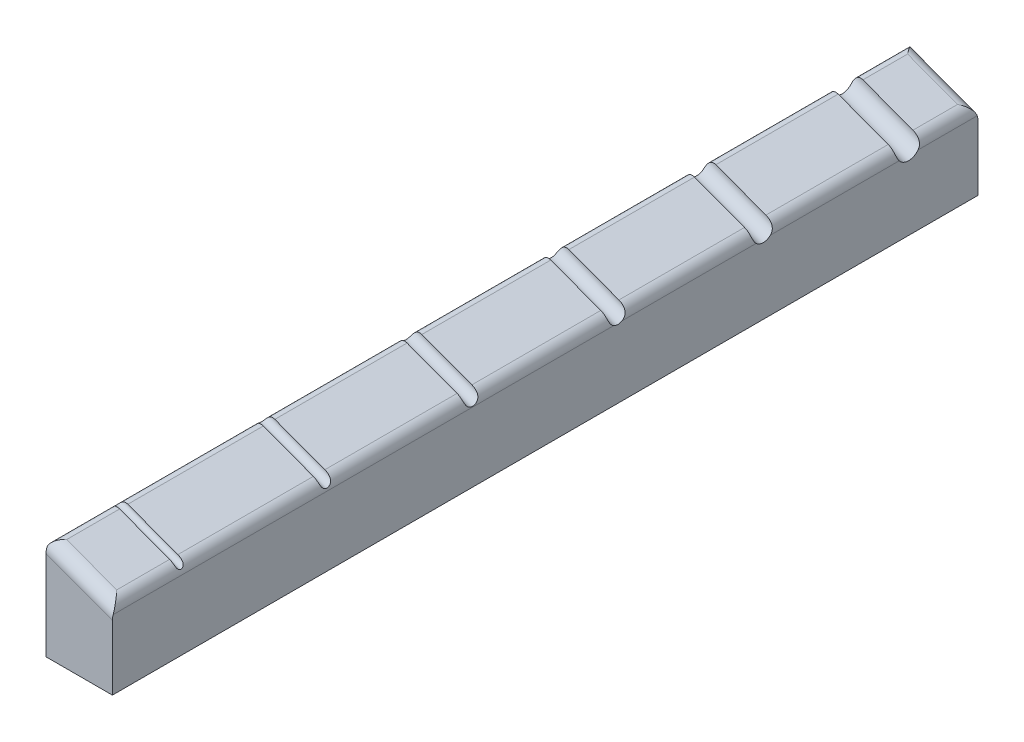
from build123d import *

# Parameters (mm, degrees)
SKETCH1_W           = 3.22
SKETCH1_H           = 41.98
BOSS_EXTRUDE1_DEPTH = 4.98
CUT_EXTRUDE1_DEPTH  = 41.98
FILLET1_R           = 0.6
FILLET2_R           = 0.3
SKETCH4_R           = 0.6
SKETCH4_R_2         = 0.2
SKETCH4_R_3         = 0.28
SKETCH4_R_4         = 0.36
SKETCH4_R_5         = 0.44
SKETCH4_R_6         = 0.52
CUT_EXTRUDE2_DEPTH  = 4.98


with BuildPart() as part:
    # Sketch1 → Boss-Extrude1 (new body)
    with BuildSketch(Plane(origin=(0, 0, 0), x_dir=(1, 0, 0), z_dir=(0, 1, 0))):
        with Locations((1.61, -20.99)):
            Rectangle(SKETCH1_W, SKETCH1_H)
    extrude(amount=BOSS_EXTRUDE1_DEPTH)

    # Sketch2 → Cut-Extrude1 (cut)
    with BuildSketch(Plane.XY.offset(41.98)):
        Polygon((0, 4.98), (3.22, 4.98), (3.22, 3.78), align=None)
    extrude(amount=-CUT_EXTRUDE1_DEPTH, mode=Mode.SUBTRACT)

    # Fillet1
    fillet1_edges = [part.edges().sort_by_distance(p)[0] for p in [
        (3.22, 3.78, 20.99),
        (1.61, 4.38, 41.98),
        (1.61, 4.38, 0),
    ]]
    fillet(fillet1_edges, radius=FILLET1_R)

    # Fillet2
    # the kernel refuses this fillet: 0.3 mm, written as the material it takes off along each edge
    with BuildSketch(Plane(origin=(0, 4.98, 42.459891752), x_dir=(0, -1, 0), z_dir=(0, 0, -1))) as fillet2_piece_1:
        with BuildLine():
            CenterArc((FILLET2_R * 1.43985566994, -FILLET2_R), FILLET2_R, 90, 110.438955915)
            Line((FILLET2_R * 0.50281089434, -FILLET2_R * 1.34920923314), (0, 0))
            Line((0, 0), (FILLET2_R * 1.43985566994, 0))
        make_face()
    extrude(amount=42.939783505, mode=Mode.SUBTRACT)

    # Sketch4 → Cut-Extrude2 (cut)
    with BuildSketch(Plane(origin=(-1.629578944, 0.607296501, 0), x_dir=(0, 0, 1), z_dir=(-0.9370447756039936, 0.3492092331443447, 0))):
        with Locations((3.365, 4.666482983)):
            Circle(SKETCH4_R)
        with Locations((38.615, 4.666482983)):
            Circle(SKETCH4_R_2)
        with Locations((31.565, 4.666482983)):
            Circle(SKETCH4_R_3)
        with Locations((24.515, 4.666482983)):
            Circle(SKETCH4_R_4)
        with Locations((17.465, 4.666482983)):
            Circle(SKETCH4_R_5)
        with Locations((10.415, 4.666482983)):
            Circle(SKETCH4_R_6)
    extrude(amount=-CUT_EXTRUDE2_DEPTH, mode=Mode.SUBTRACT)


solid = part.part
